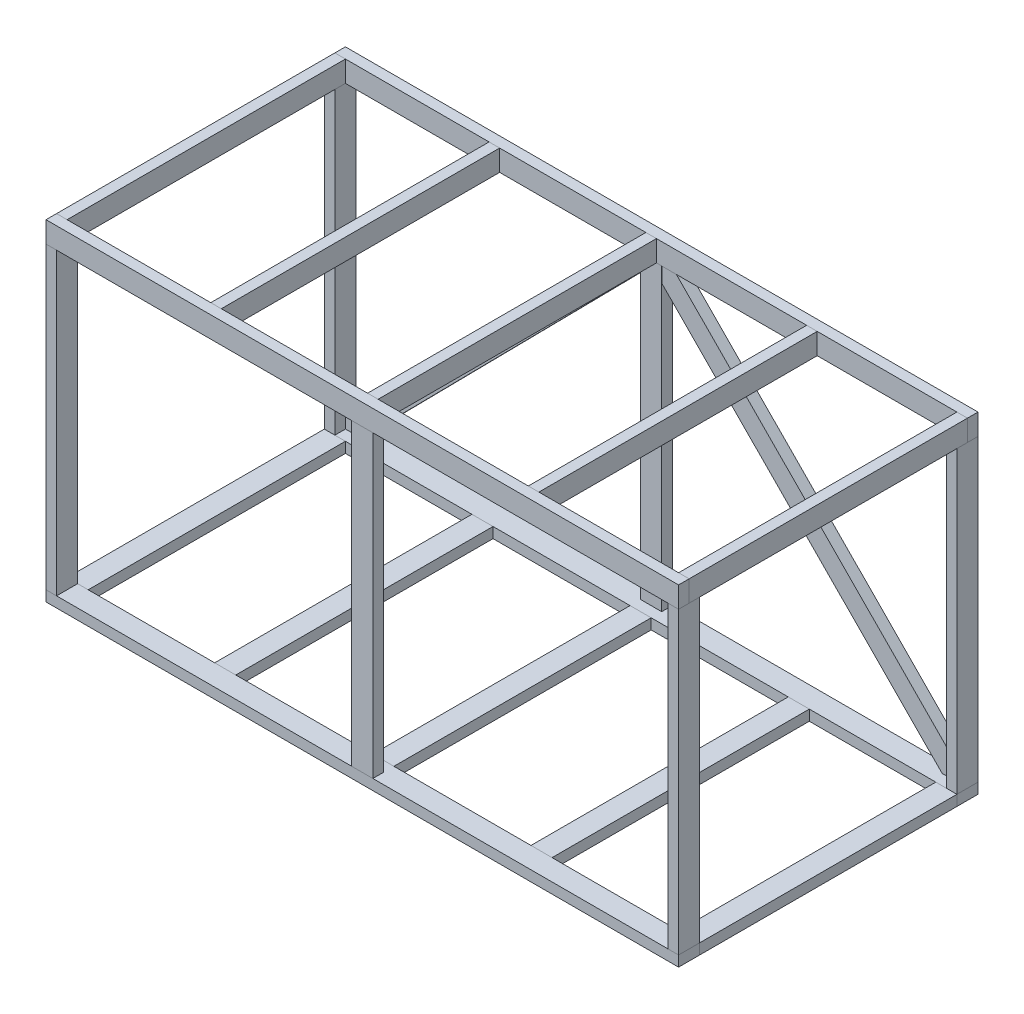
from build123d import *

# Parameters (mm, degrees)
SQUARE_RODS_SQUARE_BAR_50_1_OUTLINE_W          = 1500
SQUARE_RODS_SQUARE_BAR_50_1_OUTLINE_H          = 50
SQUARE_RODS_SQUARE_BAR_50_1_DEPTH              = 25
SQUARE_RODS_START                              = 725
SQUARE_RODS_SQUARE_BAR_50_1_2_OUTLINE_W        = 710
SQUARE_RODS_SQUARE_BAR_50_1_2_OUTLINE_H        = 50
SQUARE_RODS_SQUARE_BAR_50_1_2_DEPTH            = 25
SQUARE_RODS_SQUARE_BAR_50_1_3_OUTLINE_W        = 1500
SQUARE_RODS_SQUARE_BAR_50_1_3_OUTLINE_H        = 50
SQUARE_RODS_SQUARE_BAR_50_1_3_DEPTH            = 25
SQUARE_RODS_SQUARE_BAR_50_1_4_OUTLINE_W        = 710
SQUARE_RODS_SQUARE_BAR_50_1_4_OUTLINE_H        = 50
SQUARE_RODS_SQUARE_BAR_50_1_4_DEPTH            = 25
SQUARE_RODS_START_2                            = -305
SQUARE_RODS_SQUARE_BAR_50_1_5_OUTLINE_W        = 50
SQUARE_RODS_SQUARE_BAR_50_1_5_OUTLINE_H        = 25
SQUARE_RODS_SQUARE_BAR_50_1_5_DEPTH            = 610
SQUARE_RODS_SQUARE_BAR_50_1_6_OUTLINE_W        = 50
SQUARE_RODS_SQUARE_BAR_50_1_6_OUTLINE_H        = 25
SQUARE_RODS_SQUARE_BAR_50_1_6_DEPTH            = 610
SQUARE_RODS_START_3                            = -25
SQUARE_RODS_SQUARE_BAR_50_1_7_OUTLINE_W        = 710
SQUARE_RODS_SQUARE_BAR_50_1_7_OUTLINE_H        = 25
SQUARE_RODS_SQUARE_BAR_50_1_7_DEPTH            = 50
SQUARE_RODS_SQUARE_BAR_50_1_8_OUTLINE_W        = 50
SQUARE_RODS_SQUARE_BAR_50_1_8_OUTLINE_H        = 25
SQUARE_RODS_SQUARE_BAR_50_1_8_DEPTH            = 610
SQUARE_RODS_START_4                            = -750
SQUARE_RODS_SQUARE_BAR_50_1_9_OUTLINE_W        = 735
SQUARE_RODS_SQUARE_BAR_50_1_9_OUTLINE_H        = 50
SQUARE_RODS_SQUARE_BAR_50_1_9_DEPTH            = 25
SQUARE_RODS_SQUARE_BAR_50_1_10_OUTLINE_W       = 735
SQUARE_RODS_SQUARE_BAR_50_1_10_OUTLINE_H       = 50
SQUARE_RODS_SQUARE_BAR_50_1_10_DEPTH           = 25
SQUARE_RODS_START_5                            = -355
SQUARE_RODS_SQUARE_BAR_50_1_11_OUTLINE_W       = 1450
SQUARE_RODS_SQUARE_BAR_50_1_11_OUTLINE_H       = 50
SQUARE_RODS_SQUARE_BAR_50_1_11_DEPTH           = 25
SQUARE_RODS_SQUARE_BAR_50_1_12_OUTLINE_W       = 50
SQUARE_RODS_SQUARE_BAR_50_1_12_OUTLINE_H       = 660
SQUARE_RODS_SQUARE_BAR_50_1_12_DEPTH           = 25
SQUARE_RODS_SQUARE_BAR_50_1_13_OUTLINE_W       = 25
SQUARE_RODS_SQUARE_BAR_50_1_13_OUTLINE_H       = 50
SQUARE_RODS_SQUARE_BAR_50_1_13_DEPTH           = 610
SQUARE_RODS_START_6                            = 330
SQUARE_RODS_SQUARE_BAR_50_1_14_OUTLINE_W       = 1450
SQUARE_RODS_SQUARE_BAR_50_1_14_OUTLINE_H       = 50
SQUARE_RODS_SQUARE_BAR_50_1_14_DEPTH           = 25
SKETCH57_W                                     = 50
SKETCH57_H                                     = 25
AL_TUBE_RECTANGULAR_AL_TUBE_2_X_1_RECT_X_DEPTH = 610
SKETCH59_W                                     = 50
SKETCH59_H                                     = 25
AL_TUBE_RECTANGULAR_AL_TUBE_2_X_1_RE_2_DEPTH   = 610
SKETCH61_W                                     = 50
SKETCH61_H                                     = 25
AL_TUBE_RECTANGULAR_AL_TUBE_2_X_1_RE_3_DEPTH   = 710
SKETCH63_W                                     = 25
SKETCH63_H                                     = 50
AL_TUBE_RECTANGULAR_AL_TUBE_2_X_1_RE_4_DEPTH   = 660
SKETCH63_ON_SEGMENT_2_W                        = 25
SKETCH63_ON_SEGMENT_2_H                        = 50
AL_TUBE_RECTANGULAR_AL_TUBE_2_X_1_RE_4_2_DEPTH = 660
SKETCH63_ON_SEGMENT_3_W                        = 25
SKETCH63_ON_SEGMENT_3_H                        = 50
AL_TUBE_RECTANGULAR_AL_TUBE_2_X_1_RE_4_3_DEPTH = 660
SKETCH67_W                                     = 24.633334571
SKETCH67_H                                     = 51.788476831
AL_TUBE_RECTANGULAR_AL_TUBE_2_X_1_RE_5_DEPTH   = 997.045635866
SKETCH69_W                                     = 25
SKETCH69_H                                     = 50
AL_TUBE_RECTANGULAR_AL_TUBE_2_X_1_RE_6_DEPTH   = 997.045635866
BODY_START                                     = 305
BODY_13_RUN_ON_DEPTH                           = 50
TRIM_EXTEND1_EXTEND_2_RUN_ON                   = 25
TRIM_EXTEND2_EXTEND_2_RUN_ON                   = 25
TRIM_EXTEND3_EXTEND_2_RUN_ON                   = 25
BODY_START_2                                   = -305
BODY_13_RUN_ON_2_DEPTH                         = 50
TRIM_EXTEND4_EXTEND_2_RUN_ON                   = 25
TRIM_EXTEND6_START                             = 735
TRIM_EXTEND6_OUTLINE_W                         = 25
TRIM_EXTEND6_OUTLINE_H                         = 50
TRIM_EXTEND6_DEPTH                             = 25
TRIM_EXTEND9_START                             = 735
TRIM_EXTEND9_OUTLINE_W                         = 25
TRIM_EXTEND9_OUTLINE_H                         = 50
TRIM_EXTEND9_DEPTH                             = 25
BODY_START_3                                   = 997.045636043
BODY_21_RUN_ON_DEPTH                           = 26.41051


# Read off the part's stored shape, not the designer's step: Square-rods SQUARE BAR 50(1), Trim/Extend6, Trim/Extend9
with BuildPart() as part:
    # Square-rods SQUARE BAR 50(1) outline → Square-rods SQUARE BAR 50(1) (new body)
    with BuildSketch(Plane(origin=(0, 0, 0), x_dir=(1, 0, 0), z_dir=(0, 1, 0))):
        with Locations((0, -330)):
            Rectangle(SQUARE_RODS_SQUARE_BAR_50_1_OUTLINE_W, SQUARE_RODS_SQUARE_BAR_50_1_OUTLINE_H)
    extrude(amount=SQUARE_RODS_SQUARE_BAR_50_1_DEPTH)


with BuildPart() as body_2:
    # Square-rods SQUARE BAR 50_1 2 outline → Square-rods SQUARE BAR 50_1 2 (new body)
    with BuildSketch(Plane.YZ.offset(SQUARE_RODS_START)):
        with Locations((380, 330)):
            Rectangle(SQUARE_RODS_SQUARE_BAR_50_1_2_OUTLINE_W, SQUARE_RODS_SQUARE_BAR_50_1_2_OUTLINE_H)
    extrude(amount=SQUARE_RODS_SQUARE_BAR_50_1_2_DEPTH)


with BuildPart() as body_3:
    # Square-rods SQUARE BAR 50_1 3 outline → Square-rods SQUARE BAR 50_1 3 (new body)
    with BuildSketch(Plane(origin=(0, 0, 0), x_dir=(1, 0, 0), z_dir=(0, 1, 0))):
        with Locations((0, 330)):
            Rectangle(SQUARE_RODS_SQUARE_BAR_50_1_3_OUTLINE_W, SQUARE_RODS_SQUARE_BAR_50_1_3_OUTLINE_H)
    extrude(amount=SQUARE_RODS_SQUARE_BAR_50_1_3_DEPTH)


with BuildPart() as body_4:
    # Square-rods SQUARE BAR 50_1 4 outline → Square-rods SQUARE BAR 50_1 4 (new body)
    with BuildSketch(Plane.YZ.offset(SQUARE_RODS_START)):
        with Locations((380, -330)):
            Rectangle(SQUARE_RODS_SQUARE_BAR_50_1_4_OUTLINE_W, SQUARE_RODS_SQUARE_BAR_50_1_4_OUTLINE_H)
    extrude(amount=SQUARE_RODS_SQUARE_BAR_50_1_4_DEPTH)


with BuildPart() as body_5:
    # Square-rods SQUARE BAR 50_1 5 outline → Square-rods SQUARE BAR 50_1 5 (new body)
    with BuildSketch(Plane.XY.offset(SQUARE_RODS_START_2)):
        with Locations((-375, 12.5)):
            Rectangle(SQUARE_RODS_SQUARE_BAR_50_1_5_OUTLINE_W, SQUARE_RODS_SQUARE_BAR_50_1_5_OUTLINE_H)
    extrude(amount=SQUARE_RODS_SQUARE_BAR_50_1_5_DEPTH)


with BuildPart() as body_6:
    # Square-rods SQUARE BAR 50_1 6 outline → Square-rods SQUARE BAR 50_1 6 (new body)
    with BuildSketch(Plane.XY.offset(SQUARE_RODS_START_2)):
        with Locations((0, 12.5)):
            Rectangle(SQUARE_RODS_SQUARE_BAR_50_1_6_OUTLINE_W, SQUARE_RODS_SQUARE_BAR_50_1_6_OUTLINE_H)
    extrude(amount=SQUARE_RODS_SQUARE_BAR_50_1_6_DEPTH)


with BuildPart() as body_7:
    # Square-rods SQUARE BAR 50_1 7 outline → Square-rods SQUARE BAR 50_1 7 (new body)
    with BuildSketch(Plane.YZ.offset(SQUARE_RODS_START_3)):
        with Locations((380, 342.5)):
            Rectangle(SQUARE_RODS_SQUARE_BAR_50_1_7_OUTLINE_W, SQUARE_RODS_SQUARE_BAR_50_1_7_OUTLINE_H)
    extrude(amount=SQUARE_RODS_SQUARE_BAR_50_1_7_DEPTH)


with BuildPart() as body_8:
    # Square-rods SQUARE BAR 50_1 8 outline → Square-rods SQUARE BAR 50_1 8 (new body)
    with BuildSketch(Plane.XY.offset(SQUARE_RODS_START_2)):
        with Locations((375, 12.5)):
            Rectangle(SQUARE_RODS_SQUARE_BAR_50_1_8_OUTLINE_W, SQUARE_RODS_SQUARE_BAR_50_1_8_OUTLINE_H)
    extrude(amount=SQUARE_RODS_SQUARE_BAR_50_1_8_DEPTH)


with BuildPart() as body_9:
    # Square-rods SQUARE BAR 50_1 9 outline → Square-rods SQUARE BAR 50_1 9 (new body)
    with BuildSketch(Plane.YZ.offset(SQUARE_RODS_START_4)):
        with Locations((392.5, -330)):
            Rectangle(SQUARE_RODS_SQUARE_BAR_50_1_9_OUTLINE_W, SQUARE_RODS_SQUARE_BAR_50_1_9_OUTLINE_H)
    extrude(amount=SQUARE_RODS_SQUARE_BAR_50_1_9_DEPTH)

    # Trim/Extend9 outline → Trim/Extend9 (cut)
    with BuildSketch(Plane(origin=(0, 0, 0), x_dir=(1, 0, 0), z_dir=(0, 1, 0)).offset(TRIM_EXTEND9_START)):
        with Locations((-737.5, 330)):
            Rectangle(TRIM_EXTEND9_OUTLINE_W, TRIM_EXTEND9_OUTLINE_H)
    extrude(amount=TRIM_EXTEND9_DEPTH, mode=Mode.SUBTRACT)


with BuildPart() as body_10:
    # Square-rods SQUARE BAR 50_1 10 outline → Square-rods SQUARE BAR 50_1 10 (new body)
    with BuildSketch(Plane.YZ.offset(SQUARE_RODS_START_4)):
        with Locations((392.5, 330)):
            Rectangle(SQUARE_RODS_SQUARE_BAR_50_1_10_OUTLINE_W, SQUARE_RODS_SQUARE_BAR_50_1_10_OUTLINE_H)
    extrude(amount=SQUARE_RODS_SQUARE_BAR_50_1_10_DEPTH)

    # Trim/Extend6 outline → Trim/Extend6 (cut)
    with BuildSketch(Plane(origin=(0, 0, 0), x_dir=(1, 0, 0), z_dir=(0, 1, 0)).offset(TRIM_EXTEND6_START)):
        with Locations((-737.5, -330)):
            Rectangle(TRIM_EXTEND6_OUTLINE_W, TRIM_EXTEND6_OUTLINE_H)
    extrude(amount=TRIM_EXTEND6_DEPTH, mode=Mode.SUBTRACT)


with BuildPart() as body_11:
    # Square-rods SQUARE BAR 50_1 11 outline → Square-rods SQUARE BAR 50_1 11 (new body)
    with BuildSketch(Plane.XY.offset(SQUARE_RODS_START_5)):
        with Locations((0, 760)):
            Rectangle(SQUARE_RODS_SQUARE_BAR_50_1_11_OUTLINE_W, SQUARE_RODS_SQUARE_BAR_50_1_11_OUTLINE_H)
    extrude(amount=SQUARE_RODS_SQUARE_BAR_50_1_11_DEPTH)

    # Trim/Extend3 extend 2: the member runs on so that the trim can cut it back to the boundary (SolidWorks' 'allow extension')
    extrude(body_11.faces().sort_by_distance((725, 760, -342.5))[0], amount=TRIM_EXTEND3_EXTEND_2_RUN_ON, dir=(1, 0, 0))

    # Trim/Extend4 extend 2: the member runs on so that the trim can cut it back to the boundary (SolidWorks' 'allow extension')
    extrude(body_11.faces().sort_by_distance((-725, 760, -342.5))[0], amount=TRIM_EXTEND4_EXTEND_2_RUN_ON, dir=(-1, 0, 0))


with BuildPart() as body_12:
    # Square-rods SQUARE BAR 50_1 12 outline → Square-rods SQUARE BAR 50_1 12 (new body)
    with BuildSketch(Plane.YZ.offset(SQUARE_RODS_START)):
        with Locations((760, 0)):
            Rectangle(SQUARE_RODS_SQUARE_BAR_50_1_12_OUTLINE_W, SQUARE_RODS_SQUARE_BAR_50_1_12_OUTLINE_H)
    extrude(amount=SQUARE_RODS_SQUARE_BAR_50_1_12_DEPTH)


with BuildPart() as body_13:
    # Square-rods SQUARE BAR 50_1 13 outline → Square-rods SQUARE BAR 50_1 13 (new body)
    with BuildSketch(Plane.XY.offset(SQUARE_RODS_START_2)):
        with Locations((-737.5, 760)):
            Rectangle(SQUARE_RODS_SQUARE_BAR_50_1_13_OUTLINE_W, SQUARE_RODS_SQUARE_BAR_50_1_13_OUTLINE_H)
    extrude(amount=SQUARE_RODS_SQUARE_BAR_50_1_13_DEPTH)

    # Square-rods SQUARE BAR 50_1 13 outline → body 13 run on (add)
    with BuildSketch(Plane.XY.offset(BODY_START)):
        with Locations((-737.5, 760)):
            Rectangle(SQUARE_RODS_SQUARE_BAR_50_1_13_OUTLINE_W, SQUARE_RODS_SQUARE_BAR_50_1_13_OUTLINE_H)
    extrude(amount=BODY_13_RUN_ON_DEPTH)

    # Trim/Extend1
    split(bisect_by=Plane(origin=(0, 760, 330), x_dir=(0, 1, 0), z_dir=(0, 0, -1)), keep=Keep.TOP)

    # Square-rods SQUARE BAR 50_1 13 outline → body 13 run on 2 (add)
    with BuildSketch(Plane.XY.offset(BODY_START_2)):
        with Locations((-737.5, 760)):
            Rectangle(SQUARE_RODS_SQUARE_BAR_50_1_13_OUTLINE_W, SQUARE_RODS_SQUARE_BAR_50_1_13_OUTLINE_H)
    extrude(amount=-BODY_13_RUN_ON_2_DEPTH)

    # Trim_Extend4 3
    split(bisect_by=Plane(origin=(12.5, 760, -330), x_dir=(0, -1, 0), z_dir=(0, 0, 1)), keep=Keep.TOP)


with BuildPart() as body_14:
    # Square-rods SQUARE BAR 50_1 14 outline → Square-rods SQUARE BAR 50_1 14 (new body)
    with BuildSketch(Plane.XY.offset(SQUARE_RODS_START_6)):
        with Locations((0, 760)):
            Rectangle(SQUARE_RODS_SQUARE_BAR_50_1_14_OUTLINE_W, SQUARE_RODS_SQUARE_BAR_50_1_14_OUTLINE_H)
    extrude(amount=SQUARE_RODS_SQUARE_BAR_50_1_14_DEPTH)

    # Trim/Extend1 extend 2: the member runs on so that the trim can cut it back to the boundary (SolidWorks' 'allow extension')
    extrude(body_14.faces().sort_by_distance((-725, 760, 342.5))[0], amount=TRIM_EXTEND1_EXTEND_2_RUN_ON, dir=(-1, 0, 0))

    # Trim/Extend2 extend 2: the member runs on so that the trim can cut it back to the boundary (SolidWorks' 'allow extension')
    extrude(body_14.faces().sort_by_distance((725, 760, 342.5))[0], amount=TRIM_EXTEND2_EXTEND_2_RUN_ON, dir=(1, 0, 0))


with BuildPart() as body_15:
    # Sketch57 → Al tube rectangular AL TUBE 2 X 1 RECT X (new body)
    with BuildSketch(Plane(origin=(-750, 0, -305), x_dir=(1, 0, 0), z_dir=(0, 0, 1))):
        with Locations((25, 12.5)):
            Rectangle(SKETCH57_W, SKETCH57_H)
    extrude(amount=AL_TUBE_RECTANGULAR_AL_TUBE_2_X_1_RECT_X_DEPTH)


with BuildPart() as body_16:
    # Sketch59 → Al tube rectangular AL TUBE 2 X 1 RE 2 (new body)
    with BuildSketch(Plane(origin=(750, 0, -305), x_dir=(1, 0, 0), z_dir=(0, 0, 1))):
        with Locations((-25, 12.5)):
            Rectangle(SKETCH59_W, SKETCH59_H)
    extrude(amount=AL_TUBE_RECTANGULAR_AL_TUBE_2_X_1_RE_2_DEPTH)


with BuildPart() as body_17:
    # Sketch61 → Al tube rectangular AL TUBE 2 X 1 RE 3 (new body)
    with BuildSketch(Plane(origin=(0, 25, -355), x_dir=(-1, 0, 0), z_dir=(0, 1, 0))):
        with Locations((0, 12.5)):
            Rectangle(SKETCH61_W, SKETCH61_H)
    extrude(amount=AL_TUBE_RECTANGULAR_AL_TUBE_2_X_1_RE_3_DEPTH)


with BuildPart() as body_18:
    # Sketch63 → Al tube rectangular AL TUBE 2 X 1 RE 4 (new body)
    with BuildSketch(Plane(origin=(-371.786171595, 785, -330), x_dir=(1, 0, 0), z_dir=(0, 0, 1))):
        with Locations((0, -25)):
            Rectangle(SKETCH63_W, SKETCH63_H)
    extrude(amount=AL_TUBE_RECTANGULAR_AL_TUBE_2_X_1_RE_4_DEPTH)


with BuildPart() as body_19:
    # Sketch63 on segment 2 (carried to segment 2) → Al tube rectangular AL TUBE 2 X 1 RE 4 2 (new body)
    with BuildSketch(Plane(origin=(0, 785, -330), x_dir=(1, 0, 0), z_dir=(0, 0, 1))):
        with Locations((0, -25)):
            Rectangle(SKETCH63_ON_SEGMENT_2_W, SKETCH63_ON_SEGMENT_2_H)
    extrude(amount=AL_TUBE_RECTANGULAR_AL_TUBE_2_X_1_RE_4_2_DEPTH)


with BuildPart() as body_20:
    # Sketch63 on segment 3 (carried to segment 3) → Al tube rectangular AL TUBE 2 X 1 RE 4 3 (new body)
    with BuildSketch(Plane(origin=(381.216289359, 785, -330), x_dir=(1, 0, 0), z_dir=(0, 0, 1))):
        with Locations((0, -25)):
            Rectangle(SKETCH63_ON_SEGMENT_3_W, SKETCH63_ON_SEGMENT_3_H)
    extrude(amount=AL_TUBE_RECTANGULAR_AL_TUBE_2_X_1_RE_4_3_DEPTH)


with BuildPart() as body_21:
    # Sketch67 → Al tube rectangular AL TUBE 2 X 1 RE 5 (new body)
    with BuildSketch(Plane(origin=(-725, 25, -355), x_dir=(0.005050254648851948, -0.0049791243016836795, -0.9999748513083568), z_dir=(0.7020741827848287, 0.7121038139674686, 0))):
        with Locations((-12.493963332, -0.895495835)):
            Rectangle(SKETCH67_W, SKETCH67_H)
    extrude(amount=AL_TUBE_RECTANGULAR_AL_TUBE_2_X_1_RE_5_DEPTH)

    # Sketch67 → body 21 run on (add)
    with BuildSketch(Plane(origin=(-725, 25, -355), x_dir=(0.005050254648851948, -0.0049791243016836795, -0.9999748513083568), z_dir=(0.7020741827848287, 0.7121038139674686, 0)).offset(BODY_START_3)):
        with Locations((-12.493963332, -0.895495835)):
            Rectangle(SKETCH67_W, SKETCH67_H)
    extrude(amount=BODY_21_RUN_ON_DEPTH)

    # Trim/Extend10
    split(bisect_by=Plane(origin=(0, 735, -342.5), x_dir=(1, 0, 0), z_dir=(0, -1, 0)), keep=Keep.TOP)


with BuildPart() as body_22:
    # Sketch69 → Al tube rectangular AL TUBE 2 X 1 RE 6 (new body)
    with BuildSketch(Plane(origin=(25, 735, -355), x_dir=(-0.005050254648856833, -0.004979124301689175, 0.9999748513083568), z_dir=(0.7020741827848284, -0.7121038139674688, 0))):
        with Locations((12.322695953, 0.000129408)):
            Rectangle(SKETCH69_W, SKETCH69_H)
    extrude(amount=AL_TUBE_RECTANGULAR_AL_TUBE_2_X_1_RE_6_DEPTH)


solid = Compound([part.part, body_2.part, body_3.part, body_4.part, body_5.part, body_6.part, body_7.part, body_8.part, body_9.part, body_10.part, body_11.part, body_12.part, body_13.part, body_14.part, body_15.part, body_16.part, body_17.part, body_18.part, body_19.part, body_20.part, body_21.part, body_22.part])
